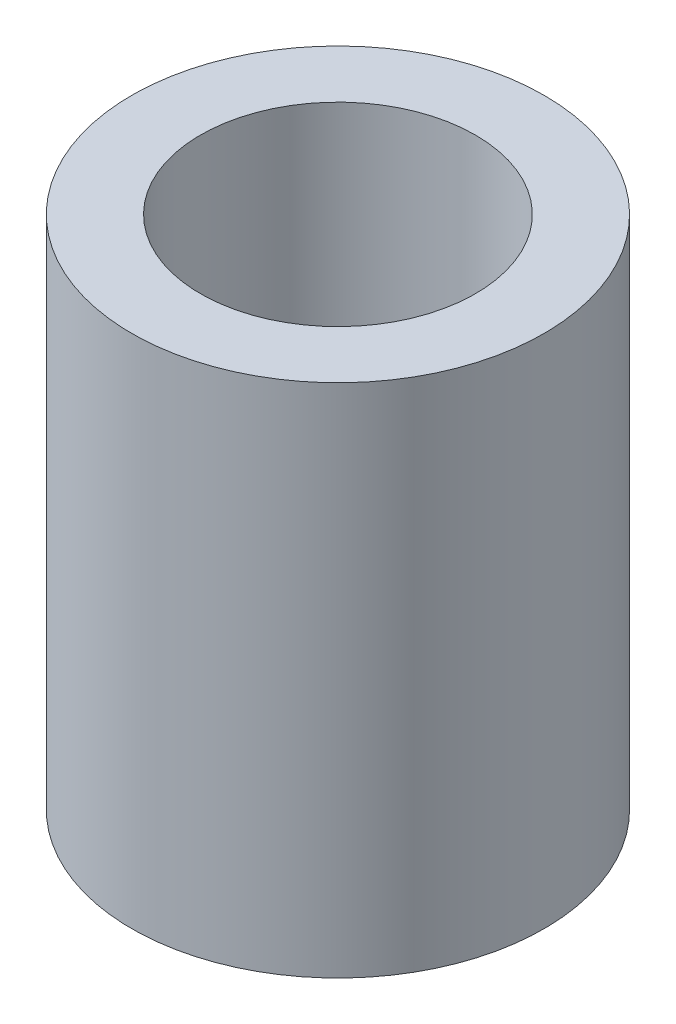
from build123d import *

# Parameters (mm, degrees)
CROQUIS1_W = 8
CROQUIS1_H = 60


with BuildPart() as part:
    # Croquis1 → Revolución1 (revolve)
    with BuildSketch(Plane(origin=(0, 0, 0), x_dir=(0, 0, -1), z_dir=(1, 0, 0))):
        with Locations((20, 30)):
            Rectangle(CROQUIS1_W, CROQUIS1_H)
    revolve(axis=Axis((0, 0, 0), (0, 1, 0)))


solid = part.part
